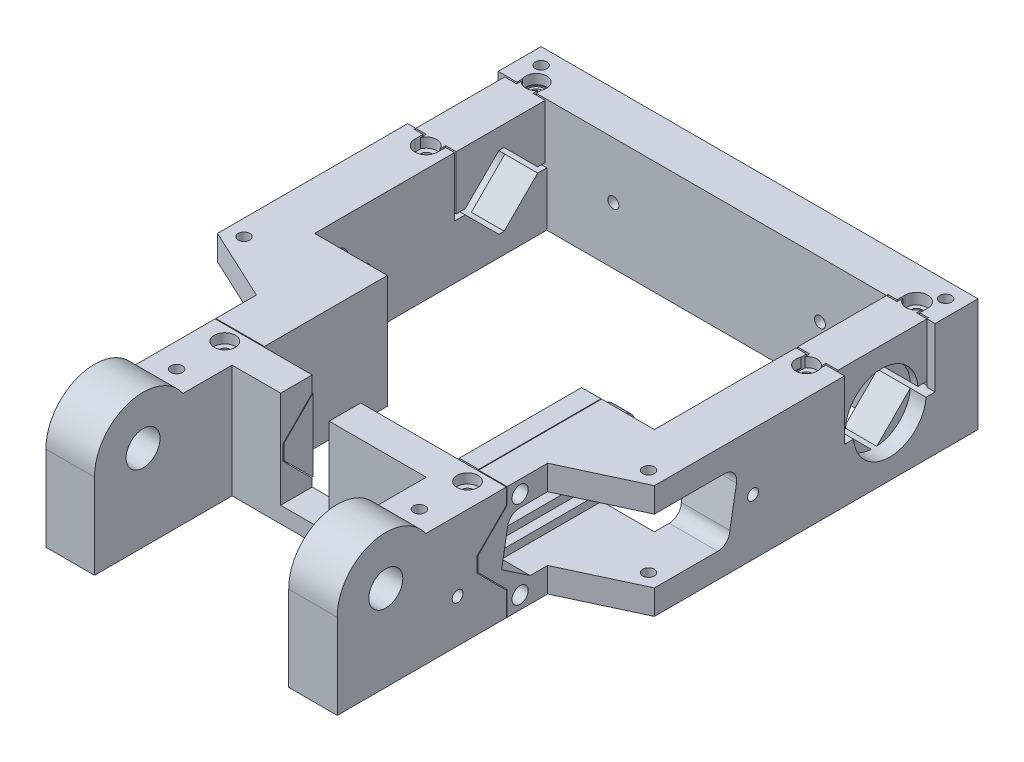
from build123d import *

# Parameters (mm, degrees)
BOSS_EXTRUDE1_DEPTH              = 30
BOSS_EXTRUDE2_DEPTH              = 5
BOSS_EXTRUDE3_DEPTH              = 15
BOSS_EXTRUDE6_START              = -75
BOSS_EXTRUDE6_DEPTH              = 15
SKETCH5_R                        = 5.25
CUT_EXTRUDE1_DEPTH               = 100
SKETCH6_W                        = 15
SKETCH6_H                        = 30
CUT_EXTRUDE2_DEPTH               = 13
CUT_EXTRUDE5_DEPTH               = 155.669001419
CUT_EXTRUDE5_DEPTH_BACK          = 155.669001419
SKETCH11_R                       = 1.25
SKETCH11_R_2                     = 7.25
CUT_EXTRUDE6_DEPTH               = 65
CUT_EXTRUDE6_DEPTH_BACK          = 65
SKETCH12_W                       = 28
SKETCH12_H                       = 30
CUT_EXTRUDE9_START               = 67.5
CUT_EXTRUDE9_DEPTH               = 31.5
CUT_EXTRUDE10_START              = -36
CUT_EXTRUDE10_DEPTH              = 31.5
BOSS_EXTRUDE7_START              = 36
BOSS_EXTRUDE7_DEPTH              = 6
CUT_EXTRUDE8_START               = 67.5
CUT_EXTRUDE8_DEPTH               = 37.5
CUT_EXTRUDE11_DEPTH              = 30
BOSS_EXTRUDE10_DEPTH             = 30
CUT_EXTRUDE12_DEPTH              = 31
SKETCH25_R                       = 11.225
BOSS_EXTRUDE11_DEPTH             = 2.36
BOSS_EXTRUDE12_START             = 2.36
BOSS_EXTRUDE12_DEPTH             = 15.87
BOSS_EXTRUDE13_START             = 18.23
SKETCH25_4_R                     = 11.225
BOSS_EXTRUDE13_DEPTH             = 2.54
CBORE_FOR_M3_SHCS1_AT_2_COUNT    = 2
CBORE_FOR_M3_SHCS1_AT_2_PITCH    = 34
CBORE_FOR_M3_SHCS1_AT_3_COUNT    = 2
CBORE_FOR_M3_SHCS1_AT_3_PITCH    = 117.5
CBORE_FOR_M3_SHCS1_AT_4_COUNT    = 2
CBORE_FOR_M3_SHCS1_AT_4_PITCH    = 122.320276324
EXTRUDE_THIN1_REACH              = 120.654
EXTRUDE_THIN1_DIRECTION_2_REACH  = 120.654
CBORE_FOR_M3_SHCS2_AT_2_COUNT    = 2
CBORE_FOR_M3_SHCS2_AT_2_PITCH    = 75
SKETCH30_W                       = 1.8
SKETCH30_H                       = 35
M3_CLEARANCE_HOLE1_AT_2_COUNT    = 2
M3_CLEARANCE_HOLE1_AT_2_PITCH    = 125
M3_CLEARANCE_HOLE1_AT_3_COUNT    = 2
M3_CLEARANCE_HOLE1_AT_3_PITCH    = 155.096517418
M3_CLEARANCE_HOLE1_AT_4_COUNT    = 2
M3_CLEARANCE_HOLE1_AT_4_PITCH    = 91.814648696
M3_CLEARANCE_HOLE1_AT_5_COUNT    = 2
M3_CLEARANCE_HOLE1_AT_5_PITCH    = 52.194849735
M3_CLEARANCE_HOLE1_AT_6_COUNT    = 2
M3_CLEARANCE_HOLE1_AT_6_PITCH    = 109.996828767
CUT_EXTRUDE14_DEPTH              = 119.65390849
HOLE2_AT_2_COUNT                 = 2
HOLE2_AT_2_PITCH                 = 63.839896251
SKETCH39_R                       = 1.7
CUT_EXTRUDE15_DEPTH              = 50
CUT_EXTRUDE16_START              = -65
CUT_EXTRUDE16_DEPTH              = 54.65390849
CUT_EXTRUDE17_START              = 65
CUT_EXTRUDE17_DEPTH              = 54.65390849
CHAMFER1_SIZE                    = 1.5
CUT_EXTRUDE18_DEPTH              = 119.65390849
CUT_EXTRUDE18_DEPTH_BACK         = 119.65390849
HOLE3_AT_2_COUNT                 = 2
HOLE3_AT_2_PITCH                 = 27
HOLE3_AT_3_COUNT                 = 2
HOLE3_AT_3_PITCH                 = 40.360872141
HOLE3_AT_4_COUNT                 = 2
HOLE3_AT_4_PITCH                 = 30
CUT_EXTRUDE19_DEPTH              = 30
CUT_EXTRUDE20_START              = -5
SKETCH48_R                       = 2.5
CUT_EXTRUDE20_DEPTH              = 14
CHAMFER2_SIZE                    = 2
CHAMFER2_SIZE_2                  = 1
CUT_EXTRUDE_THIN1_DEPTH          = 18.326267162
CUT_EXTRUDE21_DEPTH              = 119.65390849
CUT_EXTRUDE21_DEPTH_BACK         = 119.65390849
RIB1_REACH                       = 147.556
SKETCH52_WALL_W                  = 10.634427788
SKETCH52_WALL_H                  = 8
BOSS_EXTRUDE14_REACH             = 150.548
BOSS_EXTRUDE14_DIRECTION_2_REACH = 150.548
BOSS_EXTRUDE15_START             = -80.5
BOSS_EXTRUDE15_DEPTH             = 9
SKETCH54_R                       = 2.5
SKETCH54_R_2                     = 1.5
BOSS_EXTRUDE16_DEPTH             = 3


with BuildPart() as part:
    # Sketch1 → Boss-Extrude1 (new body)
    with BuildSketch(Plane(origin=(0, 0, 0), x_dir=(1, 0, 0), z_dir=(0, 1, 0))):
        Polygon((-30, -48), (30, -48), (30, -75.5), (45, -75.5), (45, -25.491922308), (67.5, -15), (67.5, 85), (-67.5, 85), (-67.5, -15), (-45, -25.491922308), (-45, -75.5), (-30, -75.5), align=None)
        Polygon((30, 0), (52.5, 0), (52.5, 70), (-52.5, 70), (-52.5, 0), (-30, 0), (-30, -38), (30, -38), align=None, mode=Mode.SUBTRACT)
    extrude(amount=BOSS_EXTRUDE1_DEPTH)

    # Sketch2 → Boss-Extrude2 (add)
    with BuildSketch(Plane.XZ):
        Polygon((-45, 75.5), (-45, 25.491922308), (-67.5, 15), (-67.5, -85), (67.5, -85), (67.5, 15), (45, 25.491922308), (45, 75.5), (30, 75.5), (30, 48), (-30, 48), (-30, 75.5), align=None)
    extrude(amount=BOSS_EXTRUDE2_DEPTH)

    # Sketch3 → Boss-Extrude3 (add)
    with BuildSketch(Plane.ZY.offset(45)):
        with BuildLine():
            Line((63.140792906, 30), (75.5, 30))
            Line((75.5, 30), (75.5, 26.5))
            ThreePointArc((75.5, 26.5), (79.035533906, 25.035533906), (80.5, 21.5))
            ThreePointArc((80.5, 21.5), (79.035533906, 17.964466094), (75.5, 16.5))
            Line((75.5, 16.5), (75.5, -5))
            Line((75.5, -5), (90.497936538, -5))
            Line((90.497936538, -5), (90.497936538, 21.251203686))
            ThreePointArc((90.497936538, 21.251203686), (80.069035183, 35.787194179), (63.140792906, 30))
        make_face()
    extrude(amount=-BOSS_EXTRUDE3_DEPTH)

    # Sketch3<3> → Boss-Extrude6 (add)
    with BuildSketch(Plane.ZY.offset(45).offset(BOSS_EXTRUDE6_START)):
        with BuildLine():
            Line((63.140792906, 30), (75.5, 30))
            Line((75.5, 30), (75.5, 26.5))
            ThreePointArc((75.5, 26.5), (79.035533906, 25.035533906), (80.5, 21.5))
            ThreePointArc((80.5, 21.5), (79.035533906, 17.964466094), (75.5, 16.5))
            Line((75.5, 16.5), (75.5, -5))
            Line((75.5, -5), (90.497936538, -5))
            Line((90.497936538, -5), (90.497936538, 21.251203686))
            ThreePointArc((90.497936538, 21.251203686), (80.069035183, 35.787194179), (63.140792906, 30))
        make_face()
    extrude(amount=-BOSS_EXTRUDE6_DEPTH)

    # Sketch5 → Cut-Extrude1 (cut)
    with BuildSketch(Plane(origin=(45, 0, 0), x_dir=(0, 0, -1), z_dir=(1, 0, 0))):
        with Locations((-75.5, 21.5)):
            Circle(SKETCH5_R)
    extrude(amount=-CUT_EXTRUDE1_DEPTH, mode=Mode.SUBTRACT)

    # Sketch6 → Cut-Extrude2 (cut)
    with BuildSketch(Plane.XY.offset(48)):
        with Locations((-7.5, 15)):
            Rectangle(SKETCH6_W, SKETCH6_H)
    extrude(amount=-CUT_EXTRUDE2_DEPTH, mode=Mode.SUBTRACT)

    # Sketch11 → Cut-Extrude5 (cut, two sides: drawn at the far end of the back side and taken through both)
    with BuildSketch(Plane.ZY.offset(-52.5).offset(-CUT_EXTRUDE5_DEPTH_BACK)):
        with Locations((-51.386038969, 18.863961031)):
            Circle(SKETCH11_R)
        with Locations((-51.386038969, 6.136038969)):
            Circle(SKETCH11_R)
        with Locations((-64.113961031, 6.136038969)):
            Circle(SKETCH11_R)
        with Locations((-57.75, 12.5)):
            Circle(SKETCH11_R_2)
        with Locations((-64.113961031, 18.863961031)):
            Circle(SKETCH11_R)
    extrude(amount=CUT_EXTRUDE5_DEPTH + CUT_EXTRUDE5_DEPTH_BACK, mode=Mode.SUBTRACT)

    # Sketch12 → Cut-Extrude6 (cut, two sides: drawn at the far end of the back side and taken through both)
    with BuildSketch(Plane(origin=(0, 0, 0), x_dir=(0, 0, -1), z_dir=(1, 0, 0)).offset(-CUT_EXTRUDE6_DEPTH_BACK)):
        with Locations((57.75, 15)):
            Rectangle(SKETCH12_W, SKETCH12_H)
    extrude(amount=CUT_EXTRUDE6_DEPTH + CUT_EXTRUDE6_DEPTH_BACK, mode=Mode.SUBTRACT)

    # Sketch20<3> → Cut-Extrude9 (cut)
    with BuildSketch(Plane(origin=(0, 0, 0), x_dir=(0, 0, -1), z_dir=(1, 0, 0)).offset(CUT_EXTRUDE9_START)):
        with BuildLine():
            Line((-37.848385804, 19.257458142), (-39.96195622, 7.018878973))
            ThreePointArc((-39.96195622, 7.018878973), (-39.135073375, 3.965201368), (-36.266656382, 2.630710415))
            Line((-36.266656382, 2.630710415), (4.572828315, 2.630710415))
            ThreePointArc((4.572828315, 2.630710415), (7.224478744, 3.729059986), (8.322828315, 6.380710415))
            Line((8.322828315, 6.380710415), (10.378693596, 17.963958657))
            ThreePointArc((10.378693596, 17.963958657), (9.560419519, 21.028128415), (6.68639873, 22.369289585))
            Line((6.68639873, 22.369289585), (-34.153085966, 22.369289585))
            ThreePointArc((-34.153085966, 22.369289585), (-36.568595013, 21.487706578), (-37.848385804, 19.257458142))
        make_face()
    extrude(amount=-CUT_EXTRUDE9_DEPTH, mode=Mode.SUBTRACT)

    # Sketch20<5> → Cut-Extrude10 (cut)
    with BuildSketch(Plane(origin=(0, 0, 0), x_dir=(0, 0, -1), z_dir=(1, 0, 0)).offset(CUT_EXTRUDE10_START)):
        with BuildLine():
            Line((-37.848385804, 19.257458142), (-39.96195622, 7.018878973))
            ThreePointArc((-39.96195622, 7.018878973), (-39.135073375, 3.965201368), (-36.266656382, 2.630710415))
            Line((-36.266656382, 2.630710415), (4.572828315, 2.630710415))
            ThreePointArc((4.572828315, 2.630710415), (7.224478744, 3.729059986), (8.322828315, 6.380710415))
            Line((8.322828315, 6.380710415), (10.378693596, 17.963958657))
            ThreePointArc((10.378693596, 17.963958657), (9.560419519, 21.028128415), (6.68639873, 22.369289585))
            Line((6.68639873, 22.369289585), (-34.153085966, 22.369289585))
            ThreePointArc((-34.153085966, 22.369289585), (-36.568595013, 21.487706578), (-37.848385804, 19.257458142))
        make_face()
    extrude(amount=-CUT_EXTRUDE10_DEPTH, mode=Mode.SUBTRACT)

    # Sketch20<4> → Boss-Extrude7 (add)
    with BuildSketch(Plane(origin=(0, 0, 0), x_dir=(0, 0, -1), z_dir=(1, 0, 0)).offset(BOSS_EXTRUDE7_START)):
        with BuildLine():
            Line((-37.848385804, 19.257458142), (-39.96195622, 7.018878973))
            ThreePointArc((-39.96195622, 7.018878973), (-39.135073375, 3.965201368), (-36.266656382, 2.630710415))
            Line((-36.266656382, 2.630710415), (4.572828315, 2.630710415))
            ThreePointArc((4.572828315, 2.630710415), (7.224478744, 3.729059986), (8.322828315, 6.380710415))
            Line((8.322828315, 6.380710415), (10.378693596, 17.963958657))
            ThreePointArc((10.378693596, 17.963958657), (9.560419519, 21.028128415), (6.68639873, 22.369289585))
            Line((6.68639873, 22.369289585), (-34.153085966, 22.369289585))
            ThreePointArc((-34.153085966, 22.369289585), (-36.568595013, 21.487706578), (-37.848385804, 19.257458142))
        make_face()
    extrude(amount=-BOSS_EXTRUDE7_DEPTH)

    # Sketch20 → Cut-Extrude8 (cut)
    with BuildSketch(Plane(origin=(0, 0, 0), x_dir=(0, 0, -1), z_dir=(1, 0, 0)).offset(CUT_EXTRUDE8_START)):
        with BuildLine():
            ThreePointArc((-14.790128826, 7.695880808), (-14.821005764, 7.788196396), (-14.851282973, 7.880710415))
            Line((-14.851282973, 7.880710415), (-34.766656382, 7.880710415))
            ThreePointArc((-34.766656382, 7.880710415), (-36.266656382, 6.380710415), (-34.766656382, 4.880710415))
            Line((-34.766656382, 4.880710415), (-16.079225015, 4.880710415))
            ThreePointArc((-16.079225015, 4.880710415), (-15.361844467, 6.254944864), (-14.790128826, 7.695880808))
        make_face()
        with BuildLine():
            ThreePointArc((-13.501032637, 4.880710415), (-14.218413185, 6.254944864), (-14.790128826, 7.695880808))
            ThreePointArc((-14.790128826, 7.695880808), (-15.361844467, 6.254944864), (-16.079225015, 4.880710415))
            Line((-16.079225015, 4.880710415), (-13.501032637, 4.880710415))
        make_face()
        with BuildLine():
            Line((4.572828315, 7.880710415), (-14.728974678, 7.880710415))
            ThreePointArc((-14.728974678, 7.880710415), (-14.759251888, 7.788196396), (-14.790128826, 7.695880808))
            ThreePointArc((-14.790128826, 7.695880808), (-14.218413185, 6.254944864), (-13.501032637, 4.880710415))
            Line((-13.501032637, 4.880710415), (4.572828315, 4.880710415))
            ThreePointArc((4.572828315, 4.880710415), (6.072828315, 6.380710415), (4.572828315, 7.880710415))
        make_face()
        with BuildLine():
            Line((-14.728974678, 7.880710415), (-14.851282973, 7.880710415))
            ThreePointArc((-14.851282973, 7.880710415), (-14.821005764, 7.788196396), (-14.790128826, 7.695880808))
            ThreePointArc((-14.790128826, 7.695880808), (-14.759251888, 7.788196396), (-14.728974678, 7.880710415))
        make_face()
        with BuildLine():
            Line((-34.153085966, 20.119289585), (6.68639873, 20.119289585))
            ThreePointArc((6.68639873, 20.119289585), (8.18639873, 18.619289585), (6.68639873, 17.119289585))
            Line((6.68639873, 17.119289585), (-34.153085966, 17.119289585))
            ThreePointArc((-34.153085966, 17.119289585), (-35.653085966, 18.619289585), (-34.153085966, 20.119289585))
        make_face()
        with BuildLine():
            ThreePointArc((-29, 14.625), (-31.125, 12.5), (-29, 10.375))
            Line((-29, 10.375), (-0.580257652, 10.375))
            ThreePointArc((-0.580257652, 10.375), (1.544742348, 12.5), (-0.580257652, 14.625))
            Line((-0.580257652, 14.625), (-29, 14.625))
        make_face()
    extrude(amount=-CUT_EXTRUDE8_DEPTH, mode=Mode.SUBTRACT)

    # Cut-Extrude11: read off the stored shape, not the designer's step
    # Cut-Extrude11 outline → Cut-Extrude11 (cut)
    with BuildSketch(Plane(origin=(0, 0, 0), x_dir=(0, 0, -1), z_dir=(1, 0, 0))):
        with BuildLine():
            Line((7.711304324, 0), (-37.291561976, 0))
            ThreePointArc((-37.291561976, 0), (-33.330127019, -1.861406616), (-29, -2.5))
            Line((-29, -2.5), (-0.580257652, -2.5))
            ThreePointArc((-0.580257652, -2.5), (3.749869367, -1.861406616), (7.711304324, 0))
        make_face()
        with BuildLine():
            ThreePointArc((-38, 24.5), (-44, 12.5), (-38, 0.5))
            Line((-38, 0.5), (-38, 24.5))
        make_face()
    extrude(amount=CUT_EXTRUDE11_DEPTH, mode=Mode.SUBTRACT)

    # Cut-Extrude12: read off the stored shape, not the designer's step
    # Cut-Extrude12 outline → Cut-Extrude12 (cut)
    with BuildSketch(Plane(origin=(0, 0, 0), x_dir=(1, 0, 0), z_dir=(0, 1, 0))):
        with BuildLine():
            ThreePointArc((-55.75, 74.75), (-58.75, 77.75), (-61.75, 74.75))
            Line((-61.75, 74.75), (-61.75, 71.75))
            Line((-61.75, 71.75), (-55.75, 71.75))
            Line((-55.75, 71.75), (-55.75, 74.75))
        make_face()
        with BuildLine():
            Line((-55.75, 40.75), (-55.75, 43.75))
            Line((-55.75, 43.75), (-61.75, 43.75))
            Line((-61.75, 43.75), (-61.75, 40.75))
            ThreePointArc((-61.75, 40.75), (-58.75, 37.75), (-55.75, 40.75))
        make_face()
    cut_extrude12 = extrude(amount=CUT_EXTRUDE12_DEPTH, mode=Mode.SUBTRACT)

    # Mirror1: Cut-Extrude12 across plane
    add(cut_extrude12.mirror(Plane(origin=(0, 0, 0), x_dir=(0, 0, 1), z_dir=(1, 0, 0))), mode=Mode.SUBTRACT)


with BuildPart() as body_2:
    # Boss-Extrude10: read off the stored shape, not the designer's step
    # Boss-Extrude10 outline → Boss-Extrude10 (new body)
    with BuildSketch(Plane(origin=(0, 0, 0), x_dir=(1, 0, 0), z_dir=(0, 1, 0))):
        with BuildLine():
            Line((-52.5, 43.75), (-52.5, 71.75))
            Line((-52.5, 71.75), (-55.75, 71.75))
            Line((-55.75, 71.75), (-55.75, 74.75))
            ThreePointArc((-55.75, 74.75), (-58.75, 77.75), (-61.75, 74.75))
            Line((-61.75, 74.75), (-61.75, 71.75))
            Line((-61.75, 71.75), (-65, 71.75))
            Line((-65, 71.75), (-65, 43.75))
            Line((-65, 43.75), (-61.75, 43.75))
            Line((-61.75, 43.75), (-61.75, 40.75))
            ThreePointArc((-61.75, 40.75), (-58.75, 37.75), (-55.75, 40.75))
            Line((-55.75, 40.75), (-55.75, 43.75))
            Line((-55.75, 43.75), (-52.5, 43.75))
        make_face()
    extrude(amount=BOSS_EXTRUDE10_DEPTH)


with BuildPart() as body_3:
    # Sketch25 → Boss-Extrude11 (new body)
    with BuildSketch(Plane(origin=(-65, 0, 0), x_dir=(0, 0, -1), z_dir=(1, 0, 0))):
        with Locations((57.75, 12.5)):
            Circle(SKETCH25_R)
    extrude(amount=BOSS_EXTRUDE11_DEPTH)

    # Sketch25<3> → Boss-Extrude12 (add)
    with BuildSketch(Plane(origin=(-65, 0, 0), x_dir=(0, 0, -1), z_dir=(1, 0, 0)).offset(BOSS_EXTRUDE12_START)):
        with BuildLine():
            Line((56.923732838, 23.694548119), (46.555451881, 13.326267162))
            ThreePointArc((46.555451881, 13.326267162), (46.525, 12.5), (46.555451881, 11.673732838))
            Line((46.555451881, 11.673732838), (56.923732838, 1.305451881))
            ThreePointArc((56.923732838, 1.305451881), (57.75, 1.275), (58.576267162, 1.305451881))
            Line((58.576267162, 1.305451881), (68.944548119, 11.673732838))
            ThreePointArc((68.944548119, 11.673732838), (68.967384446, 12.08658594), (68.975, 12.5))
            ThreePointArc((68.975, 12.5), (68.967384446, 12.91341406), (68.944548119, 13.326267162))
            Line((68.944548119, 13.326267162), (58.576267162, 23.694548119))
            ThreePointArc((58.576267162, 23.694548119), (57.75, 23.725), (56.923732838, 23.694548119))
        make_face()
    extrude(amount=BOSS_EXTRUDE12_DEPTH)

    # Sketch25<4> → Boss-Extrude13 (add)
    with BuildSketch(Plane(origin=(-65, 0, 0), x_dir=(0, 0, -1), z_dir=(1, 0, 0)).offset(BOSS_EXTRUDE13_START)):
        with Locations((57.75, 12.5)):
            Circle(SKETCH25_4_R)
    extrude(amount=BOSS_EXTRUDE13_DEPTH)


with BuildPart() as body_2_1:
    add(body_2.part)

    # Combine3: cut body 3
    add(body_3.part, mode=Mode.SUBTRACT)


with BuildPart() as body_3_2:
    # Split2: the piece on the far side of the plane
    add(body_2_1.part)
    split(bisect_by=Plane.ZX.offset(11.673732838), keep=Keep.BOTTOM)


with BuildPart() as body_2_2:
    add(body_2_1.part)

    # Split2
    split(bisect_by=Plane.ZX.offset(11.673732838), keep=Keep.TOP)


with BuildPart() as cbore_for_m3_shcs1_tool:
    # Sketch24 → CBORE for M3 SHCS1 (revolve)
    with BuildSketch(Plane(origin=(-58.75, 30, -40.75), x_dir=(0, 0, 1), z_dir=(1, 0, 0))):
        Polygon((0, 0), (0, 36.021463052), (1.7, 35), (1.7, 3), (3.25, 3), (3.25, 0), align=None)
    cbore_for_m3_shcs1 = revolve(axis=Axis((-58.75, 36.35, -40.75), (0, -1, 0)))


with BuildPart() as part_1:
    add(part.part)

    # CBORE for M3 SHCS1: cut by cbore_for_m3_shcs1_tool
    add(cbore_for_m3_shcs1_tool.part, mode=Mode.SUBTRACT)


with BuildPart() as body_2_3:
    add(body_2_2.part)

    # CBORE for M3 SHCS1: cut by cbore_for_m3_shcs1_tool
    add(cbore_for_m3_shcs1_tool.part, mode=Mode.SUBTRACT)


with BuildPart() as body_3_2_1:
    add(body_3_2.part)

    # CBORE for M3 SHCS1: cut by cbore_for_m3_shcs1_tool
    add(cbore_for_m3_shcs1_tool.part, mode=Mode.SUBTRACT)


with BuildPart() as cbore_for_m3_shcs1_at_2_tool:
    # CBORE for M3 SHCS1 at 2: CBORE for M3 SHCS1 ×2
    with Locations(*[(0, 0, -i * CBORE_FOR_M3_SHCS1_AT_2_PITCH) for i in range(1, CBORE_FOR_M3_SHCS1_AT_2_COUNT)]):
        add(cbore_for_m3_shcs1)


with BuildPart() as part_2:
    add(part_1.part)

    # CBORE for M3 SHCS1 at 2: cut by cbore_for_m3_shcs1_at_2_tool
    add(cbore_for_m3_shcs1_at_2_tool.part, mode=Mode.SUBTRACT)

    # CBORE for M3 SHCS1 at 3: CBORE for M3 SHCS1 ×2
    with Locations(*[(i * CBORE_FOR_M3_SHCS1_AT_3_PITCH, 0, 0) for i in range(1, CBORE_FOR_M3_SHCS1_AT_3_COUNT)]):
        add(cbore_for_m3_shcs1, mode=Mode.SUBTRACT)

    # CBORE for M3 SHCS1 at 4: CBORE for M3 SHCS1 ×2
    with Locations(*[Vector(0.9605929902307302, 0, -0.27795882270506245) * (i * CBORE_FOR_M3_SHCS1_AT_4_PITCH) for i in range(1, CBORE_FOR_M3_SHCS1_AT_4_COUNT)]):
        add(cbore_for_m3_shcs1, mode=Mode.SUBTRACT)


with BuildPart() as body_2_4:
    add(body_2_3.part)

    # CBORE for M3 SHCS1 at 2: cut by cbore_for_m3_shcs1_at_2_tool
    add(cbore_for_m3_shcs1_at_2_tool.part, mode=Mode.SUBTRACT)


with BuildPart() as body_3_2_2:
    add(body_3_2_1.part)

    # CBORE for M3 SHCS1 at 2: cut by cbore_for_m3_shcs1_at_2_tool
    add(cbore_for_m3_shcs1_at_2_tool.part, mode=Mode.SUBTRACT)


with BuildPart() as body_4:
    # Mirror2: mirrored copy
    add(body_3_2_2.part.mirror(Plane(origin=(0, 0, 0), x_dir=(0, 0, 1), z_dir=(1, 0, 0))))


with BuildPart() as part_3:
    add(part_2.part)

    # Combine4: read off the stored shape, not the designer's step
    # Combine4: union body 4, body 3 2
    add(body_4.part)
    add(body_3_2_2.part)


with BuildPart() as body_3_3:
    # Mirror3: mirrored copy
    add(body_2_4.part.mirror(Plane(origin=(0, 0, 0), x_dir=(0, 0, 1), z_dir=(1, 0, 0))))


with BuildPart() as body_4_2:

    # Extrude-Thin1: up to this face of the body (flat: up to its plane)
    extrude_thin1_end = Plane(part_3.part.faces().sort_by_distance((45, 13.224548571, 61.421242934))[0])
    # Sketch26 → Extrude-Thin1 (new, up to the picked face)
    with BuildSketch(Plane(origin=(0, 0, 0), x_dir=(0, 0, -1), z_dir=(1, 0, 0)), mode=Mode.PRIVATE) as extrude_thin1_sk1:
        Polygon((-38, 30), (-38, 25), (-47, 16), (-47, 11.5), (-38, 2.5), (-38, -5), (-38.25, -5), (-38.25, 2.396446609), (-47.25, 11.396446609), (-47.25, 16.103553391), (-38.25, 25.103553391), (-38.25, 30), align=None)
    extrude_thin1_tool1 = split(extrude(extrude_thin1_sk1.sketch, amount=EXTRUDE_THIN1_REACH, mode=Mode.PRIVATE), bisect_by=extrude_thin1_end, keep=Keep.BOTH, mode=Mode.PRIVATE)
    add(extrude_thin1_tool1.solids().sort_by(Axis((0, 27.5, 38.036202), (1, 0, 0)))[0])


    # Extrude-Thin1 direction 2: up to this face of the body (flat: up to its plane)
    extrude_thin1_direction_2_end = Plane(part_3.part.faces().sort_by_distance((-45, 13.224548571, 61.421242934))[0])
    # Sketch26 → Extrude-Thin1 direction 2 (add, up to the picked face)
    with BuildSketch(Plane(origin=(0, 0, 0), x_dir=(0, 0, -1), z_dir=(1, 0, 0)), mode=Mode.PRIVATE) as extrude_thin1_direction_2_sk1:
        Polygon((-38, 30), (-38, 25), (-47, 16), (-47, 11.5), (-38, 2.5), (-38, -5), (-38.25, -5), (-38.25, 2.396446609), (-47.25, 11.396446609), (-47.25, 16.103553391), (-38.25, 25.103553391), (-38.25, 30), align=None)
    extrude_thin1_direction_2_tool1 = split(extrude(extrude_thin1_direction_2_sk1.sketch, amount=-EXTRUDE_THIN1_DIRECTION_2_REACH, mode=Mode.PRIVATE), bisect_by=extrude_thin1_direction_2_end, keep=Keep.BOTH, mode=Mode.PRIVATE)
    add(extrude_thin1_direction_2_tool1.solids().sort_by(Axis((0, 27.5, 38.036202), (-1, 0, 0)))[0])


with BuildPart() as part_4:
    add(part_3.part)

    # Sketch28 → CBORE for M3 SHCS2 (revolve, cut)
    with BuildSketch(Plane(origin=(37.5, 30, 42.75), x_dir=(0, 0, 1), z_dir=(1, 0, 0))):
        Polygon((0, 0), (0, 35), (1.7, 35), (1.7, 3), (3.25, 3), (3.25, 0), align=None)
    cbore_for_m3_shcs2 = revolve(axis=Axis((37.5, 36.35, 42.75), (0, -1, 0)), mode=Mode.SUBTRACT)

    # CBORE for M3 SHCS2 at 2: CBORE for M3 SHCS2 ×2
    with Locations(*[(-i * CBORE_FOR_M3_SHCS2_AT_2_PITCH, 0, 0) for i in range(1, CBORE_FOR_M3_SHCS2_AT_2_COUNT)]):
        add(cbore_for_m3_shcs2, mode=Mode.SUBTRACT)

    # Combine5: cut body 4 2
    add(body_4_2.part, mode=Mode.SUBTRACT)

    # Sketch30 → M3 Clearance Hole1 (revolve, cut)
    with BuildSketch(Plane(origin=(-62.5, 30, 11.814648696), x_dir=(0, 0, 1), z_dir=(1, 0, 0))):
        with Locations((0.9, 17.5)):
            Rectangle(SKETCH30_W, SKETCH30_H)
    m3_clearance_hole1 = revolve(axis=Axis((-62.5, 36.35, 11.814648696), (0, -1, 0)), mode=Mode.SUBTRACT)

    # M3 Clearance Hole1 at 2: M3 Clearance Hole1 ×2
    with Locations(*[(i * M3_CLEARANCE_HOLE1_AT_2_PITCH, 0, 0) for i in range(1, M3_CLEARANCE_HOLE1_AT_2_COUNT)]):
        add(m3_clearance_hole1, mode=Mode.SUBTRACT)

    # M3 Clearance Hole1 at 3: M3 Clearance Hole1 ×2
    with Locations(*[Vector(0.8059497536181827, 0, -0.5919839479604078) * (i * M3_CLEARANCE_HOLE1_AT_3_PITCH) for i in range(1, M3_CLEARANCE_HOLE1_AT_3_COUNT)]):
        add(m3_clearance_hole1, mode=Mode.SUBTRACT)

    # M3 Clearance Hole1 at 4: M3 Clearance Hole1 ×2
    with Locations(*[(0, 0, -i * M3_CLEARANCE_HOLE1_AT_4_PITCH) for i in range(1, M3_CLEARANCE_HOLE1_AT_4_COUNT)]):
        add(m3_clearance_hole1, mode=Mode.SUBTRACT)

    # M3 Clearance Hole1 at 5: M3 Clearance Hole1 ×2
    with Locations(*[Vector(0.4789744606429942, 0, 0.8778288364207186) * (i * M3_CLEARANCE_HOLE1_AT_5_PITCH) for i in range(1, M3_CLEARANCE_HOLE1_AT_5_COUNT)]):
        add(m3_clearance_hole1, mode=Mode.SUBTRACT)

    # M3 Clearance Hole1 at 6: M3 Clearance Hole1 ×2
    with Locations(*[Vector(0.9091171183826895, 0, 0.4165405923359151) * (i * M3_CLEARANCE_HOLE1_AT_6_PITCH) for i in range(1, M3_CLEARANCE_HOLE1_AT_6_COUNT)]):
        add(m3_clearance_hole1, mode=Mode.SUBTRACT)

    # Sketch34 → Cut-Extrude14 (cut, through all)
    with BuildSketch(Plane(origin=(0, 0, 0), x_dir=(1, 0, 0), z_dir=(0, 1, 0))):
        Polygon((30, 0), (30, -37.291561976), (30, -38), (-30, -38), (-30, 0), (-52.5, 0), (-52.5, 71.75), (52.5, 71.75), (52.5, 0), align=None)
    extrude(amount=-CUT_EXTRUDE14_DEPTH, mode=Mode.SUBTRACT)

    # Sketch36 → Hole1 (revolve, cut)
    with BuildSketch(Plane(origin=(-120, 12.39688985, -15.451100734), x_dir=(0, 0, 1), z_dir=(0, 1, 0))):
        Polygon((0, 0), (0, 67.5), (1.7, 67.5), (1.7, 16), (3, 16), (3, 0), align=None)
    hole1 = revolve(axis=Axis((-10, 12.39688985, -15.451100734), (-1, 0, 0)), mode=Mode.SUBTRACT)

    # Mirror4: Hole1 across Right Plane
    add(hole1.mirror(Plane(origin=(0, 0, 0), x_dir=(0, 0, -1), z_dir=(1, 0, 0))), mode=Mode.SUBTRACT)

    # Sketch38 → Hole2 (revolve, cut)
    with BuildSketch(Plane(origin=(31.919948125, 12.665240192, -105.845444128), x_dir=(0, 1, 0), z_dir=(1, 0, 0))):
        Polygon((0, 0), (0, 34.095444128), (1.7, 34.095444128), (1.7, 4), (3, 4), (3, 0), align=None)
    hole2 = revolve(axis=Axis((31.919948125, 12.665240192, 4.154555872), (0, 0, -1)), mode=Mode.SUBTRACT)

    # Hole2 at 2: Hole2 ×2
    with Locations(*[(-i * HOLE2_AT_2_PITCH, 0, 0) for i in range(1, HOLE2_AT_2_COUNT)]):
        add(hole2, mode=Mode.SUBTRACT)

    # Sketch39 → Cut-Extrude15 (cut)
    with BuildSketch(Plane(origin=(80, 0, 0), x_dir=(0, 0, -1), z_dir=(1, 0, 0))):
        with Locations((-53.294944095, 8.283400622)):
            Circle(SKETCH39_R)
    extrude(amount=-CUT_EXTRUDE15_DEPTH, mode=Mode.SUBTRACT)

    # Sketch40 → Cut-Extrude16 (cut, through all)
    with BuildSketch(Plane(origin=(0, 0, 0), x_dir=(0, 0, -1), z_dir=(1, 0, 0)).offset(CUT_EXTRUDE16_START)):
        with BuildLine():
            Line((68.944548119, 11.673732838), (71.75, 11.673732838))
            Line((71.75, 11.673732838), (71.75, 30))
            Line((71.75, 30), (43.75, 30))
            Line((43.75, 30), (43.75, 11.673732838))
            Line((43.75, 11.673732838), (46.555451881, 11.673732838))
            ThreePointArc((46.555451881, 11.673732838), (57.75, 1.275), (68.944548119, 11.673732838))
        make_face()
    extrude(amount=-CUT_EXTRUDE16_DEPTH, mode=Mode.SUBTRACT)

    # Sketch40<2> → Cut-Extrude17 (cut, through all)
    with BuildSketch(Plane(origin=(0, 0, 0), x_dir=(0, 0, -1), z_dir=(1, 0, 0)).offset(CUT_EXTRUDE17_START)):
        with BuildLine():
            Line((68.944548119, 11.673732838), (71.75, 11.673732838))
            Line((71.75, 11.673732838), (71.75, 30))
            Line((71.75, 30), (43.75, 30))
            Line((43.75, 30), (43.75, 11.673732838))
            Line((43.75, 11.673732838), (46.555451881, 11.673732838))
            ThreePointArc((46.555451881, 11.673732838), (57.75, 1.275), (68.944548119, 11.673732838))
        make_face()
    extrude(amount=CUT_EXTRUDE17_DEPTH, mode=Mode.SUBTRACT)

    # Chamfer1
    chamfer1_edges = [part_4.edges().sort_by_distance(p)[0] for p in [
        (30, 10.375, 14.790128826),
        (30, 12.5, -1.544742348),
        (30, 14.625, 14.790128826),
        (30, 12.5, 31.125),
    ]]
    chamfer(chamfer1_edges, length=CHAMFER1_SIZE)

    # Sketch41 → Cut-Extrude18 (cut, two sides: drawn at the far end of the back side and taken through both)
    with BuildSketch(Plane(origin=(0, 0, 0), x_dir=(1, 0, 0), z_dir=(0, 1, 0)).offset(-CUT_EXTRUDE18_DEPTH_BACK)):
        Polygon((30, -38), (36.2, -38), (36.2, 0), (36, 0), (36, -37.8), (30, -37.8), align=None)
    extrude(amount=CUT_EXTRUDE18_DEPTH + CUT_EXTRUDE18_DEPTH_BACK, mode=Mode.SUBTRACT)

    # Sketch44 → Hole3 (revolve, cut)
    with BuildSketch(Plane(origin=(30, -1, 4), x_dir=(0, 0, 1), z_dir=(0, 1, 0))):
        Polygon((0, 0), (0, 15), (2.5, 15), (2.5, 3), (3.25, 3), (3.25, 0), align=None)
    hole3 = revolve(axis=Axis((140, -1, 4), (-1, 0, 0)), mode=Mode.SUBTRACT)

    # Hole3 at 2: Hole3 ×2
    with Locations(*[(0, i * HOLE3_AT_2_PITCH, 0) for i in range(1, HOLE3_AT_2_COUNT)]):
        add(hole3, mode=Mode.SUBTRACT)

    # Hole3 at 3: Hole3 ×2
    with Locations(*[Vector(0, 0.6689647316224497, 0.7432941462471663) * (i * HOLE3_AT_3_PITCH) for i in range(1, HOLE3_AT_3_COUNT)]):
        add(hole3, mode=Mode.SUBTRACT)

    # Hole3 at 4: Hole3 ×2
    with Locations(*[(0, 0, i * HOLE3_AT_4_PITCH) for i in range(1, HOLE3_AT_4_COUNT)]):
        add(hole3, mode=Mode.SUBTRACT)

    # Cut-Extrude19: read off the stored shape, not the designer's step
    # Cut-Extrude19 outline → Cut-Extrude19 (cut)
    with BuildSketch(Plane.YZ):
        with BuildLine():
            Line((11.5, 47), (7.716990566, 43.216990566))
            ThreePointArc((7.716990566, 43.216990566), (16.952581931, 43.323914065), (24.5, 38))
            Line((24.5, 38), (25, 38))
            Line((25, 38), (16, 47))
            Line((16, 47), (11.5, 47))
        make_face()
    extrude(amount=CUT_EXTRUDE19_DEPTH, mode=Mode.SUBTRACT)

    # CSK for M3 Flat Head Machine Screw1: read off the stored shape, not the designer's step
    # CSK for M3 Flat Head Machine Screw1 outl → CSK for M3 Flat Head Machine Screw1 (revolve, cut)
    with BuildSketch(Plane(origin=(-37.5, 0, 75.5), x_dir=(1, 0, 0), z_dir=(0, 0, 1))):
        Polygon((1.7, -3.55), (1.7, 16.533023042), (0, 16.533023042), (0, -5), (3.15, -5), align=None)
    revolve(axis=Axis((-37.5, 0, 75.5), (0, 1, 0)), mode=Mode.SUBTRACT)

    # CSK for M3 Flat Head Machine Screw1 2 ou → CSK for M3 Flat Head Machine Screw1 2 (revolve, cut)
    with BuildSketch(Plane(origin=(37.5, 0, 75.5), x_dir=(1, 0, 0), z_dir=(0, 0, 1))):
        Polygon((1.7, -3.55), (1.7, 16.533023042), (0, 16.533023042), (0, -5), (3.15, -5), align=None)
    revolve(axis=Axis((37.5, 0, 75.5), (0, 1, 0)), mode=Mode.SUBTRACT)

    # Sketch48 → Cut-Extrude20 (cut)
    with BuildSketch(Plane(origin=(0, 0, 0), x_dir=(1, 0, 0), z_dir=(0, 1, 0)).offset(CUT_EXTRUDE20_START)):
        with Locations(Location((-37.5, -75.5, 0), (0, 0, 90))):
            Circle(SKETCH48_R)
        with Locations(Location((37.5, -75.5, 0), (0, 0, 90))):
            Circle(SKETCH48_R)
    extrude(amount=CUT_EXTRUDE20_DEPTH, mode=Mode.SUBTRACT)

    # Chamfer2
    # the kernel refuses this chamfer: 2, 1 mm, written as the material it takes off along each edge
    with BuildSketch(Plane(origin=(-37.5, 9, 75.5), x_dir=(1, 0, 0), z_dir=(0, 0, 1))) as chamfer2_piece_1_section:
        Polygon((1.7, CHAMFER2_SIZE), (1.7 + CHAMFER2_SIZE_2, 0), (1.7, 0), align=None)
    chamfer2_piece_1 = revolve(axis=Axis((-37.5, 9, 75.5), (0, 1, 0)), mode=Mode.PRIVATE)
    chamfer2_piece_1 = chamfer2_piece_1 & Plane(origin=(-37.5, 9, 75.5), x_dir=(0, 0, -1), z_dir=(0, -1, 0)) * Cylinder(2.5, 11, mode=Mode.PRIVATE)
    add(chamfer2_piece_1, mode=Mode.SUBTRACT)
    with BuildSketch(Plane(origin=(37.5, 9, 75.5), x_dir=(1, 0, 0), z_dir=(0, 0, 1))) as chamfer2_piece_2_section:
        Polygon((1.7, CHAMFER2_SIZE), (1.7 + CHAMFER2_SIZE_2, 0), (1.7, 0), align=None)
    chamfer2_piece_2 = revolve(axis=Axis((37.5, 9, 75.5), (0, 1, 0)), mode=Mode.PRIVATE)
    chamfer2_piece_2 = chamfer2_piece_2 & Plane(origin=(37.5, 9, 75.5), x_dir=(0, 0, -1), z_dir=(0, -1, 0)) * Cylinder(2.5, 11, mode=Mode.PRIVATE)
    add(chamfer2_piece_2, mode=Mode.SUBTRACT)


with BuildPart() as cut_extrude_thin1_tool:
    # Sketch49 → Cut-Extrude-Thin1 (new body)
    with BuildSketch(Plane(origin=(0, 11.673732838, 0), x_dir=(1, 0, 0), z_dir=(0, 1, 0))):
        with BuildLine():
            Line((-65, 43.75), (-61.75, 43.75))
            Line((-61.75, 43.75), (-61.75, 40.75))
            ThreePointArc((-61.75, 40.75), (-58.75, 37.75), (-55.75, 40.75))
            Line((-55.75, 40.75), (-55.75, 43.75))
            Line((-55.75, 43.75), (-52.5, 43.75))
            Line((-52.5, 43.75), (-52.5, 43.25))
            Line((-52.5, 43.25), (-55.25, 43.25))
            Line((-55.25, 43.25), (-55.25, 40.75))
            ThreePointArc((-55.25, 40.75), (-58.75, 37.25), (-62.25, 40.75))
            Line((-62.25, 40.75), (-62.25, 43.25))
            Line((-62.25, 43.25), (-65, 43.25))
            Line((-65, 43.25), (-65, 43.75))
        make_face()
        with BuildLine():
            Line((-65, 71.75), (-61.75, 71.75))
            Line((-61.75, 71.75), (-61.75, 74.75))
            ThreePointArc((-61.75, 74.75), (-58.75, 77.75), (-55.75, 74.75))
            Line((-55.75, 74.75), (-55.75, 71.75))
            Line((-55.75, 71.75), (-52.5, 71.75))
            Line((-52.5, 71.75), (-52.5, 71.25))
            Line((-52.5, 71.25), (-56.25, 71.25))
            Line((-56.25, 71.25), (-56.25, 74.75))
            ThreePointArc((-56.25, 74.75), (-58.75, 77.25), (-61.25, 74.75))
            Line((-61.25, 74.75), (-61.25, 71.25))
            Line((-61.25, 71.25), (-65, 71.25))
            Line((-65, 71.25), (-65, 71.75))
        make_face()
        with BuildLine():
            Line((65, 71.75), (61.75, 71.75))
            Line((61.75, 71.75), (61.75, 74.75))
            ThreePointArc((61.75, 74.75), (58.75, 77.75), (55.75, 74.75))
            Line((55.75, 74.75), (55.75, 71.75))
            Line((55.75, 71.75), (52.5, 71.75))
            Line((52.5, 71.75), (52.5, 72.25))
            Line((52.5, 72.25), (55.25, 72.25))
            Line((55.25, 72.25), (55.25, 74.75))
            ThreePointArc((55.25, 74.75), (58.75, 78.25), (62.25, 74.75))
            Line((62.25, 74.75), (62.25, 72.25))
            Line((62.25, 72.25), (65, 72.25))
            Line((65, 72.25), (65, 71.75))
        make_face()
        with BuildLine():
            Line((65, 43.75), (61.75, 43.75))
            Line((61.75, 43.75), (61.75, 40.75))
            ThreePointArc((61.75, 40.75), (58.75, 37.75), (55.75, 40.75))
            Line((55.75, 40.75), (55.75, 43.75))
            Line((55.75, 43.75), (52.5, 43.75))
            Line((52.5, 43.75), (52.5, 44.25))
            Line((52.5, 44.25), (56.25, 44.25))
            Line((56.25, 44.25), (56.25, 40.75))
            ThreePointArc((56.25, 40.75), (58.75, 38.25), (61.25, 40.75))
            Line((61.25, 40.75), (61.25, 44.25))
            Line((61.25, 44.25), (65, 44.25))
            Line((65, 44.25), (65, 43.75))
        make_face()
    extrude(amount=CUT_EXTRUDE_THIN1_DEPTH)


with BuildPart() as part_5:
    add(part_4.part)

    # Cut-Extrude-Thin1: cut by cut_extrude_thin1_tool
    add(cut_extrude_thin1_tool.part, mode=Mode.SUBTRACT)

    # Sketch52 wall → Rib1 (add, up to next)
    with BuildSketch(Plane(origin=(40.5, 5.60687289, 35.285559936), x_dir=(0, -0.559722165426, -0.828680334949), z_dir=(0, 0.828680334949, -0.559722165426)), mode=Mode.PRIVATE) as rib1_sk1:
        Rectangle(SKETCH52_WALL_W, SKETCH52_WALL_H)
    rib1_tool1 = extrude(rib1_sk1.sketch, amount=-RIB1_REACH, mode=Mode.PRIVATE) - part_5.part
    add(rib1_tool1.solids().sort_by_distance((40.5, 5.60687289, 35.285559936))[0])

    # Boss-Extrude14: up to this face of the body (flat: up to its plane)
    boss_extrude14_end = Plane(part_5.part.faces().sort_by_distance((45, 13.239266046, 66.122722233))[0])
    # Sketch53 → Boss-Extrude14 (add, up to the picked face)
    with BuildSketch(Plane(origin=(44.5, 0, 0), x_dir=(0, 0, -1), z_dir=(1, 0, 0)), mode=Mode.PRIVATE) as boss_extrude14_sk1:
        with BuildLine():
            Line((-36.266656382, 2.630710415), (-30.879289345, 2.630710415))
            Line((-30.879289345, 2.630710415), (-39.691830527, 8.583035365))
            Line((-39.691830527, 8.583035365), (-39.96195622, 7.018878973))
            ThreePointArc((-39.96195622, 7.018878973), (-39.135073375, 3.965201368), (-36.266656382, 2.630710415))
        make_face()
    boss_extrude14_tool1 = split(extrude(boss_extrude14_sk1.sketch, amount=BOSS_EXTRUDE14_REACH, mode=Mode.PRIVATE), bisect_by=boss_extrude14_end, keep=Keep.BOTH, mode=Mode.PRIVATE)
    add(boss_extrude14_tool1.solids().sort_by(Axis((44.5, 4.790024, 36.661832), (1, 0, 0)))[0])

    # Boss-Extrude14 direction 2: up to this face of the body (flat: up to its plane)
    boss_extrude14_direction_2_end = Plane(part_5.part.faces().sort_by_distance((36.2, 26.149972964, 19.241176435))[0])
    # Sketch53 → Boss-Extrude14 direction 2 (add, up to the picked face)
    with BuildSketch(Plane(origin=(44.5, 0, 0), x_dir=(0, 0, -1), z_dir=(1, 0, 0)), mode=Mode.PRIVATE) as boss_extrude14_direction_2_sk1:
        with BuildLine():
            Line((-36.266656382, 2.630710415), (-30.879289345, 2.630710415))
            Line((-30.879289345, 2.630710415), (-39.691830527, 8.583035365))
            Line((-39.691830527, 8.583035365), (-39.96195622, 7.018878973))
            ThreePointArc((-39.96195622, 7.018878973), (-39.135073375, 3.965201368), (-36.266656382, 2.630710415))
        make_face()
    boss_extrude14_direction_2_tool1 = split(extrude(boss_extrude14_direction_2_sk1.sketch, amount=-BOSS_EXTRUDE14_DIRECTION_2_REACH, mode=Mode.PRIVATE), bisect_by=boss_extrude14_direction_2_end, keep=Keep.BOTH, mode=Mode.PRIVATE)
    add(boss_extrude14_direction_2_tool1.solids().sort_by(Axis((44.5, 4.790024, 36.661832), (-1, 0, 0)))[0])

    # Sketch53<2> → Boss-Extrude15 (add)
    with BuildSketch(Plane(origin=(44.5, 0, 0), x_dir=(0, 0, -1), z_dir=(1, 0, 0)).offset(BOSS_EXTRUDE15_START)):
        with BuildLine():
            Line((-36.266656382, 2.630710415), (-30.879289345, 2.630710415))
            Line((-30.879289345, 2.630710415), (-39.691830527, 8.583035365))
            Line((-39.691830527, 8.583035365), (-39.96195622, 7.018878973))
            ThreePointArc((-39.96195622, 7.018878973), (-39.135073375, 3.965201368), (-36.266656382, 2.630710415))
        make_face()
    extrude(amount=-BOSS_EXTRUDE15_DEPTH)

    # Sketch54 → Boss-Extrude16 (add)
    # profile 1 of 4: a face of its own
    with BuildSketch(Plane.ZY.offset(-33)):
        with Locations((4, 26)):
            Circle(SKETCH54_R)
        with Locations((4, 26)):
            Circle(SKETCH54_R_2, mode=Mode.SUBTRACT)
    # profile 2 of 4: a face of its own
    with BuildSketch(Plane.ZY.offset(-33)):
        with Locations((34, 26)):
            Circle(SKETCH54_R)
        with Locations((34, 26)):
            Circle(SKETCH54_R_2, mode=Mode.SUBTRACT)
    # profile 3 of 4: a face of its own
    with BuildSketch(Plane.ZY.offset(-33)):
        with Locations((4, -1)):
            Circle(SKETCH54_R)
        with Locations((4, -1)):
            Circle(SKETCH54_R_2, mode=Mode.SUBTRACT)
    # profile 4 of 4: a face of its own
    with BuildSketch(Plane.ZY.offset(-33)):
        with Locations((34, -1)):
            Circle(SKETCH54_R)
        with Locations((34, -1)):
            Circle(SKETCH54_R_2, mode=Mode.SUBTRACT)
    extrude(amount=-BOSS_EXTRUDE16_DEPTH)


with BuildPart() as body_2_5:
    add(body_2_4.part)

    # Cut-Extrude-Thin1: cut by cut_extrude_thin1_tool
    add(cut_extrude_thin1_tool.part, mode=Mode.SUBTRACT)


with BuildPart() as body_3_3_1:
    add(body_3_3.part)

    # Cut-Extrude-Thin1: cut by cut_extrude_thin1_tool
    add(cut_extrude_thin1_tool.part, mode=Mode.SUBTRACT)


with BuildPart() as cut_extrude21_tool:
    # Sketch50 → Cut-Extrude21 (new, two sides: drawn at the far end of the back side and taken through both)
    with BuildSketch(Plane(origin=(0, 0, 0), x_dir=(0, 0, -1), z_dir=(1, 0, 0)).offset(-CUT_EXTRUDE21_DEPTH_BACK)):
        Polygon((43.75, 11.673732838), (71.75, 11.673732838), (77.75, 11.673732838), (77.75, 13.326267162), (71.75, 13.326267162), (43.75, 13.326267162), (37.75, 13.326267162), (37.75, 11.673732838), align=None)
    extrude(amount=CUT_EXTRUDE21_DEPTH + CUT_EXTRUDE21_DEPTH_BACK)


with BuildPart() as body_2_6:
    add(body_2_5.part)

    # Cut-Extrude21: cut by cut_extrude21_tool
    add(cut_extrude21_tool.part, mode=Mode.SUBTRACT)


with BuildPart() as body_3_3_2:
    add(body_3_3_1.part)

    # Cut-Extrude21: cut by cut_extrude21_tool
    add(cut_extrude21_tool.part, mode=Mode.SUBTRACT)


solid = Compound([part_5.part, body_2_6.part, body_3_3_2.part])
